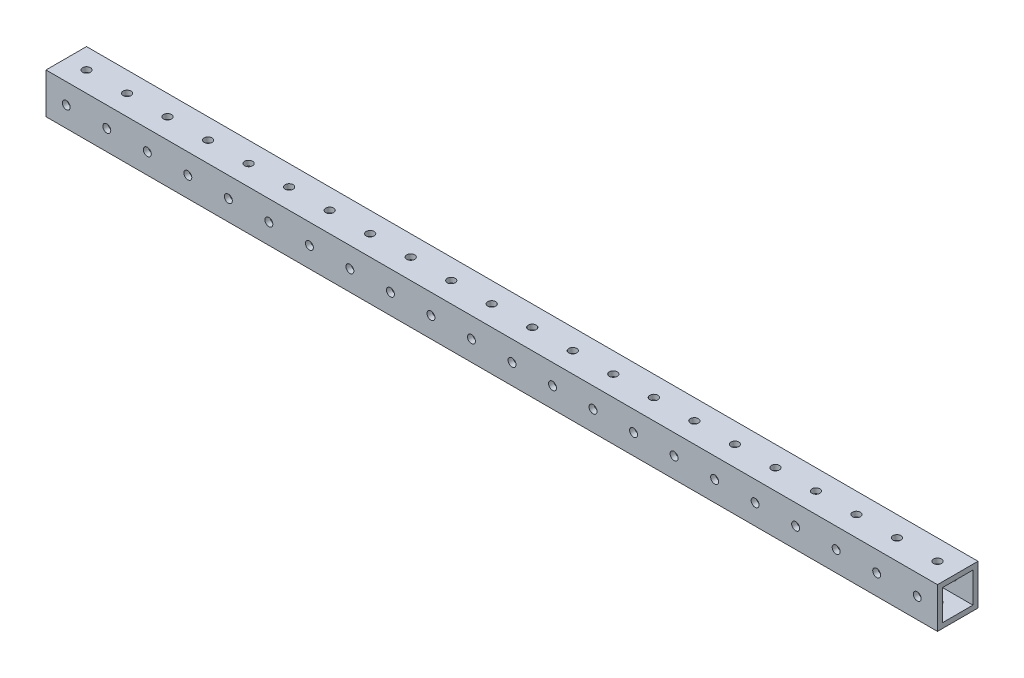
from build123d import *

# Parameters (mm, degrees)
SKETCH1_W             = 25.4
SKETCH1_H             = 25.4
SKETCH1_W_2           = 19.05
SKETCH1_H_2           = 19.05
BOSS_EXTRUDE1_DEPTH   = 279.4
SKETCH3_W             = 2.4892
SKETCH3_H             = 25.4
SKETCH3_AT_POINT_2_W  = 2.4892
SKETCH3_AT_POINT_2_H  = 25.4
LPATTERN1_START       = -12.7
LPATTERN1_OUTLINE_R   = 2.4892
LPATTERN1_DEPTH       = 25.4
LPATTERN1_2_OUTLINE_R = 2.4892
LPATTERN1_2_DEPTH     = 25.4


# Read off the part's stored shape, not the designer's step: LPattern1
with BuildPart() as part:
    # Sketch1 → Boss-Extrude1 (new, symmetric)
    with BuildSketch(Plane(origin=(0, 0, 0), x_dir=(0, 0, -1), z_dir=(1, 0, 0))):
        Rectangle(SKETCH1_W, SKETCH1_H)
        Rectangle(SKETCH1_W_2, SKETCH1_H_2, mode=Mode.SUBTRACT)
    extrude(amount=BOSS_EXTRUDE1_DEPTH, both=True)

    # Sketch3 → #9 (0.196) Diameter Hole1 (revolve, cut)
    with BuildSketch(Plane(origin=(266.7, 12.7, 0), x_dir=(0, 0, 1), z_dir=(1, 0, 0))):
        with Locations((1.2446, 12.7)):
            Rectangle(SKETCH3_W, SKETCH3_H)
    revolve(axis=Axis((266.7, 19.05, 0), (0, -1, 0)), mode=Mode.SUBTRACT)

    # Sketch3 at point 2 (carried to point 2, square into its face) → #9 (0.196) Diameter Hole1 at 2 (revolve, cut)
    with BuildSketch(Plane(origin=(266.7, 0, 12.7), x_dir=(0, -1, 0), z_dir=(1, 0, 0))):
        with Locations((1.2446, 12.7)):
            Rectangle(SKETCH3_AT_POINT_2_W, SKETCH3_AT_POINT_2_H)
    revolve(axis=Axis((266.7, 0, 19.05), (0, 0, -1)), mode=Mode.SUBTRACT)

    # LPattern1 outline → LPattern1 (cut)
    with BuildSketch(Plane.XY.offset(LPATTERN1_START)):
        with Locations((241.3, 0)):
            Circle(LPATTERN1_OUTLINE_R)
        with Locations((215.9, 0)):
            Circle(LPATTERN1_OUTLINE_R)
        with Locations((190.5, 0)):
            Circle(LPATTERN1_OUTLINE_R)
        with Locations((165.1, 0)):
            Circle(LPATTERN1_OUTLINE_R)
        with Locations((139.7, 0)):
            Circle(LPATTERN1_OUTLINE_R)
        with Locations((114.3, 0)):
            Circle(LPATTERN1_OUTLINE_R)
        with Locations((88.9, 0)):
            Circle(LPATTERN1_OUTLINE_R)
        with Locations((63.5, 0)):
            Circle(LPATTERN1_OUTLINE_R)
        with Locations((38.1, 0)):
            Circle(LPATTERN1_OUTLINE_R)
        with Locations((12.7, 0)):
            Circle(LPATTERN1_OUTLINE_R)
        with Locations((-12.7, 0)):
            Circle(LPATTERN1_OUTLINE_R)
        with Locations((-38.1, 0)):
            Circle(LPATTERN1_OUTLINE_R)
        with Locations((-63.5, 0)):
            Circle(LPATTERN1_OUTLINE_R)
        with Locations((-88.9, 0)):
            Circle(LPATTERN1_OUTLINE_R)
        with Locations((-114.3, 0)):
            Circle(LPATTERN1_OUTLINE_R)
        with Locations((-139.7, 0)):
            Circle(LPATTERN1_OUTLINE_R)
        with Locations((-165.1, 0)):
            Circle(LPATTERN1_OUTLINE_R)
        with Locations((-190.5, 0)):
            Circle(LPATTERN1_OUTLINE_R)
        with Locations((-215.9, 0)):
            Circle(LPATTERN1_OUTLINE_R)
        with Locations((-241.3, 0)):
            Circle(LPATTERN1_OUTLINE_R)
        with Locations((-266.7, 0)):
            Circle(LPATTERN1_OUTLINE_R)
    extrude(amount=LPATTERN1_DEPTH, mode=Mode.SUBTRACT)

    # LPattern1 2 outline → LPattern1 2 (cut)
    with BuildSketch(Plane(origin=(0, 0, 0), x_dir=(1, 0, 0), z_dir=(0, 1, 0)).offset(LPATTERN1_START)):
        with Locations((241.3, 0)):
            Circle(LPATTERN1_2_OUTLINE_R)
        with Locations((215.9, 0)):
            Circle(LPATTERN1_2_OUTLINE_R)
        with Locations((190.5, 0)):
            Circle(LPATTERN1_2_OUTLINE_R)
        with Locations((165.1, 0)):
            Circle(LPATTERN1_2_OUTLINE_R)
        with Locations((139.7, 0)):
            Circle(LPATTERN1_2_OUTLINE_R)
        with Locations((114.3, 0)):
            Circle(LPATTERN1_2_OUTLINE_R)
        with Locations((88.9, 0)):
            Circle(LPATTERN1_2_OUTLINE_R)
        with Locations((63.5, 0)):
            Circle(LPATTERN1_2_OUTLINE_R)
        with Locations((38.1, 0)):
            Circle(LPATTERN1_2_OUTLINE_R)
        with Locations((12.7, 0)):
            Circle(LPATTERN1_2_OUTLINE_R)
        with Locations((-12.7, 0)):
            Circle(LPATTERN1_2_OUTLINE_R)
        with Locations((-38.1, 0)):
            Circle(LPATTERN1_2_OUTLINE_R)
        with Locations((-63.5, 0)):
            Circle(LPATTERN1_2_OUTLINE_R)
        with Locations((-88.9, 0)):
            Circle(LPATTERN1_2_OUTLINE_R)
        with Locations((-114.3, 0)):
            Circle(LPATTERN1_2_OUTLINE_R)
        with Locations((-139.7, 0)):
            Circle(LPATTERN1_2_OUTLINE_R)
        with Locations((-165.1, 0)):
            Circle(LPATTERN1_2_OUTLINE_R)
        with Locations((-190.5, 0)):
            Circle(LPATTERN1_2_OUTLINE_R)
        with Locations((-215.9, 0)):
            Circle(LPATTERN1_2_OUTLINE_R)
        with Locations((-241.3, 0)):
            Circle(LPATTERN1_2_OUTLINE_R)
        with Locations((-266.7, 0)):
            Circle(LPATTERN1_2_OUTLINE_R)
    extrude(amount=LPATTERN1_2_DEPTH, mode=Mode.SUBTRACT)


solid = part.part
